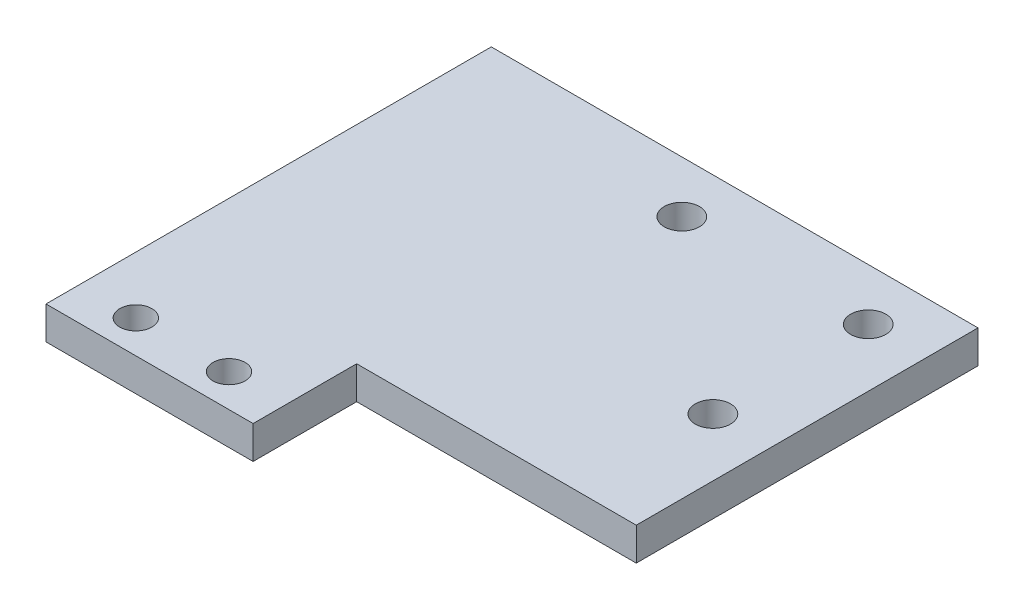
from build123d import *

# Parameters (mm, degrees)
SKETCH1_R           = 1.55
SKETCH1_R_2         = 1.7
BOSS_EXTRUDE1_DEPTH = 3.175


with BuildPart() as part:
    # Sketch1 → Boss-Extrude1 (new body)
    with BuildSketch(Plane(origin=(0, 0, 0), x_dir=(1, 0, 0), z_dir=(0, 1, 0))):
        Polygon((0, 0), (0, 43), (47, 43), (47, 10), (20, 10), (20, 0), align=None)
        with Locations((14.5, 3.175)):
            Circle(SKETCH1_R, mode=Mode.SUBTRACT)
        with Locations((5.5, 3.175)):
            Circle(SKETCH1_R, mode=Mode.SUBTRACT)
        with Locations((41.4, 23)):
            Circle(SKETCH1_R_2, mode=Mode.SUBTRACT)
        with Locations((41.4, 38)):
            Circle(SKETCH1_R_2, mode=Mode.SUBTRACT)
        with Locations((23.4, 38)):
            Circle(SKETCH1_R_2, mode=Mode.SUBTRACT)
    extrude(amount=BOSS_EXTRUDE1_DEPTH)


solid = part.part
